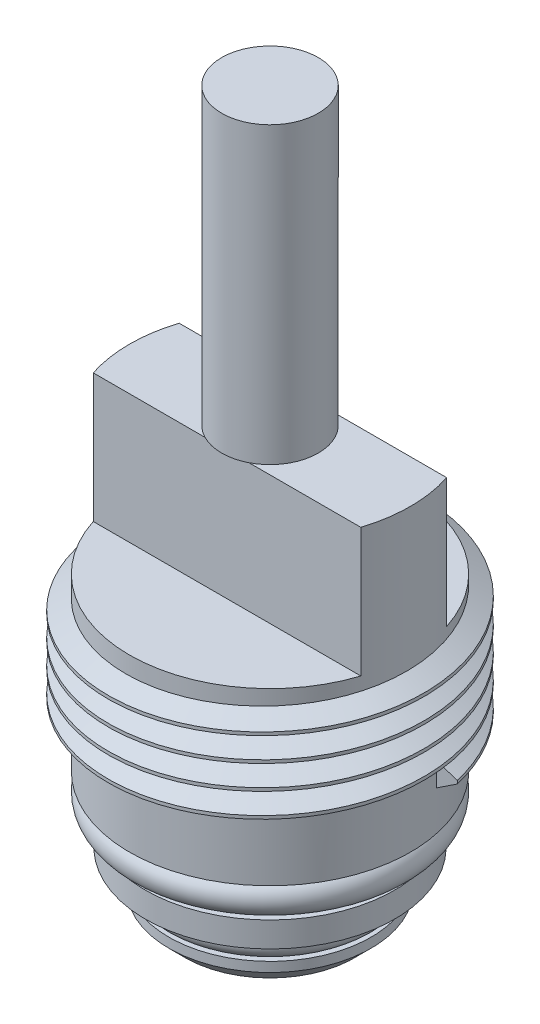
from build123d import *

# Parameters (mm, degrees)
SKETCH1_W          = 1.5
SKETCH1_H          = 9.144
SKETCH1_5_R        = 0.425
SKETCH1_5_R_2      = 0.5225
SKETCH2_W          = 8.73
SKETCH2_H          = 3.03
CUT_EXTRUDE1_DEPTH = 4
THREAD1_PITCH      = 0.75
CHAMFER1_SIZE      = 0.5


with BuildPart() as part:
    # Sketch1 → Revolve2 (revolve)
    with BuildSketch(Plane.XY):
        with Locations((-0.75, 9.2244)):
            Rectangle(SKETCH1_W, SKETCH1_H)
        Polygon((0, -4.6524), (0, 4.6524), (-1.5, 4.6524), (-4.365, 4.6524), (-4.365, -4.6524), (-3.842499977, -4.6524), (-3.32, -4.6524), align=None)
        Polygon((0, -5.9224), (0, -4.6524), (-3.32, -4.6524), (-3.32, -5.1749), (-3.32, -5.9224), align=None)
        Polygon((0, -6.7024), (0, -5.9224), (-3.32, -5.9224), (-3.87, -5.9224), (-3.87, -6.7024), (-2.825, -6.7024), align=None)
        Polygon((0, -8.3524), (0, -7.5524), (-2.825, -7.5524), (-3.14, -7.5524), (-3.14, -8.3524), align=None)
    revolve(axis=Axis((0, 13.7964, 0), (0, -1, 0)))

    # Sketch2 → Cut-Extrude1 (cut)
    with BuildSketch(Plane(origin=(0, 4.6524, 0), x_dir=(1, 0, 0), z_dir=(0, 1, 0))):
        with Locations((0, 2.85)):
            Rectangle(SKETCH2_W, SKETCH2_H)
        with Locations((0, -2.85)):
            Rectangle(SKETCH2_W, SKETCH2_H)
    extrude(amount=-CUT_EXTRUDE1_DEPTH, mode=Mode.SUBTRACT)

    # Thread1: the profile of Thread Profile1 profile screwed along a right-hand helix of 4.466667 turns, 8 arcs to a turn; built about Z, then put on its axis
    thread1_z = Axis((0, 0, 0), (0, 0, 1))
    thread1_corners = [(4.3647, 0, -0.000173205), (4.906265875, 0, 0.312499999), (4.906265875, 0, 0.412499999), (4.3647, 0, 0.725173202)]
    with BuildLine(mode=Mode.PRIVATE) as thread1_profile:
        Line(thread1_corners[0], thread1_corners[1])
        Line(thread1_corners[1], thread1_corners[2])
        Line(thread1_corners[2], thread1_corners[3])
        Line(thread1_corners[3], thread1_corners[0])
    thread1_cap = Face(thread1_profile.wire())
    thread1_turn_angles = [0, 22.5, 45, 67.5, 90, 112.5, 135, 157.5, 180, 202.5, 225, 247.5, 270, 292.5, 315, 337.5, 360]
    thread1_turn_weights = [1, 0.9238795325112867, 1, 0.9238795325112867, 1, 0.9238795325112867, 1, 0.9238795325112867, 1, 0.9238795325112867, 1, 0.9238795325112867, 1, 0.9238795325112867, 1, 0.9238795325112867, 1]
    thread1_turn_rails = [Edge.make_bspline([Vector(p[0], p[1], 0).rotate(thread1_z, thread1_turn_angles[k]) / thread1_turn_weights[k] + Vector(0, 0, p[2] + THREAD1_PITCH * thread1_turn_angles[k] / 360) for k in range(17)], [0, 0, 0, 1, 1, 2, 2, 3, 3, 4, 4, 5, 5, 6, 6, 7, 7, 8, 8, 8], 2, thread1_turn_weights) for p in thread1_corners]
    thread1_turn_sides = [Face.make_surface_from_curves(thread1_turn_rails[p[0]], thread1_turn_rails[p[1]]) for p in [(0, 1), (1, 2), (2, 3), (3, 0)]]
    thread1_last_angles = [1440, 1462.5, 1485, 1507.5, 1530, 1552.5, 1575, 1591.5, 1608]
    thread1_last_weights = [1, 0.9238795325112867, 1, 0.9238795325112867, 1, 0.9238795325112867, 1, 0.958819734868193, 1]
    thread1_last_rails = [Edge.make_bspline([Vector(p[0], p[1], 0).rotate(thread1_z, thread1_last_angles[k]) / thread1_last_weights[k] + Vector(0, 0, p[2] + THREAD1_PITCH * thread1_last_angles[k] / 360) for k in range(9)], [0, 0, 0, 1, 1, 2, 2, 3, 3, 4, 4, 4], 2, thread1_last_weights) for p in thread1_corners]
    thread1_last_sides = [Face.make_surface_from_curves(thread1_last_rails[p[0]], thread1_last_rails[p[1]]) for p in [(0, 1), (1, 2), (2, 3), (3, 0)]]
    thread1 = Plane(origin=(0, 0.6524, 0), x_dir=(-1, 0, 0), z_dir=(0, -1, 0)) * Solid(Shell([*[p.moved(Location((0, 0, THREAD1_PITCH * i))) for i in range(4) for p in thread1_turn_sides], *thread1_last_sides, thread1_cap, thread1_cap.rotate(thread1_z, 1608).moved(Location((0, 0, THREAD1_PITCH * 1608 / 360)))]))
    add(thread1)

    # Chamfer1
    chamfer1_edges = [part.edges().sort_by_distance(p)[0] for p in [
        (3.14, -8.3524, 0),
    ]]
    chamfer(chamfer1_edges, length=CHAMFER1_SIZE)


with BuildPart() as body_2:
    # Sketch1<5> → Revolve3 (revolve)
    with BuildSketch(Plane.XY):
        with Locations((-2.825, -7.1274)):
            Circle(SKETCH1_5_R)
        with Locations((-3.8425, -5.1749)):
            Circle(SKETCH1_5_R_2)
    revolve(axis=Axis((0, 13.7964, 0), (0, -1, 0)))


solid = Compound([part.part, body_2.part])
